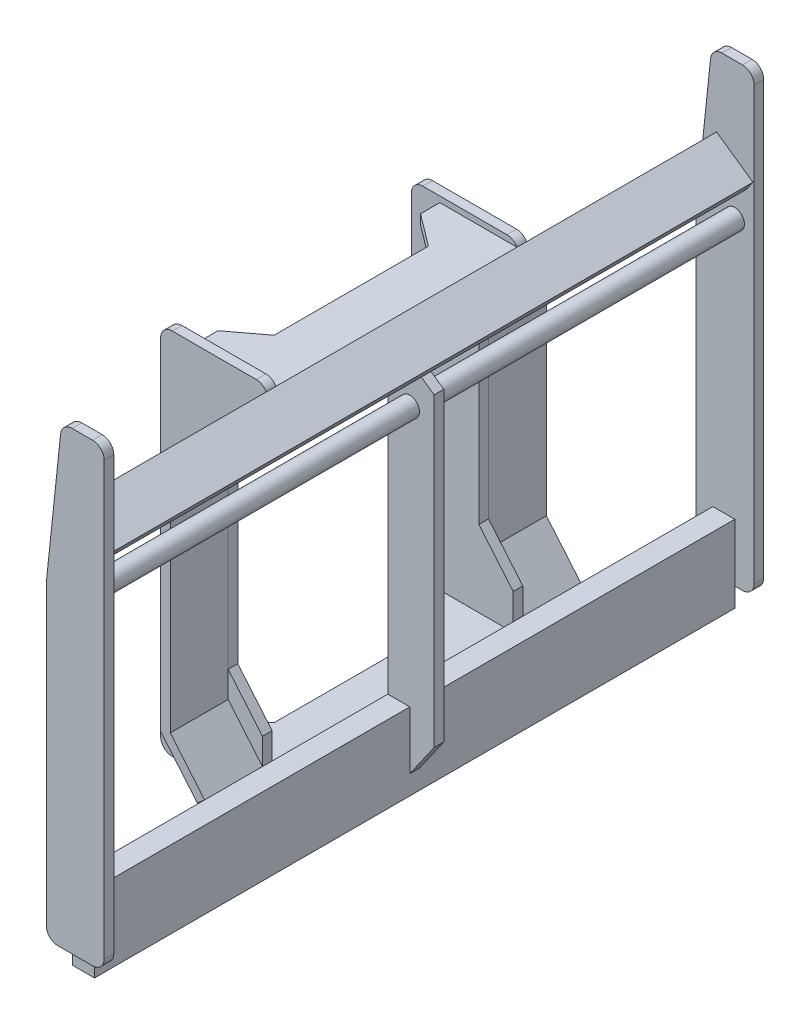
from build123d import *

# Parameters (mm, degrees)
BOSS_EXTRUDE1_START = 830
BOSS_EXTRUDE1_DEPTH = 25
BOSS_EXTRUDE2_START = -830
BOSS_EXTRUDE2_DEPTH = 25
SKETCH2_W           = 57
SKETCH2_H           = 200
BOSS_EXTRUDE3_DEPTH = 1660
BOSS_EXTRUDE4_DEPTH = 12.5
SKETCH4_R           = 25
CUT_EXTRUDE1_DEPTH  = 2084.026644093
SKETCH5_R           = 25
BOSS_EXTRUDE5_DEPTH = 1710
BOSS_EXTRUDE6_START = 300
BOSS_EXTRUDE6_DEPTH = 25
EXTRUDE_THIN1_DEPTH = 150
BOSS_EXTRUDE7_REACH = 1429.616
SKETCH9_W           = 150
SKETCH9_H           = 25
BOSS_EXTRUDE8_DEPTH = 25
LPATTERN1_COUNT     = 2
LPATTERN1_PITCH     = 870
FILLET1_R           = 30


with BuildPart() as part:
    # Sketch1 → Boss-Extrude1 (new body)
    with BuildSketch(Plane.XY.offset(BOSS_EXTRUDE1_START)):
        Polygon((0, 0), (0, 1180), (-110, 1180), (-150, 800), (-150, 0), align=None)
    extrude(amount=BOSS_EXTRUDE1_DEPTH)



with BuildPart() as body_2:
    # Sketch1<2> → Boss-Extrude2 (new body)
    with BuildSketch(Plane.XY.offset(BOSS_EXTRUDE2_START)):
        Polygon((0, 0), (0, 1180), (-110, 1180), (-150, 800), (-150, 0), align=None)
    extrude(amount=-BOSS_EXTRUDE2_DEPTH)


with BuildPart() as part_1:
    add(part.part)

    add(body_2.part)  # Boss-Extrude3 merges body 2
    # Sketch2 → Boss-Extrude3 (add)
    with BuildSketch(Plane.XY.offset(-830)):
        Polygon((-3, 930), (-20.207293091, 905.425438671), (-114.409778184, 971.386728852), (-97.202485093, 995.96129018), align=None)
        with Locations((-78.5, 50)):
            Rectangle(SKETCH2_W, SKETCH2_H)
    extrude(amount=BOSS_EXTRUDE3_DEPTH)

    # Sketch3 → Boss-Extrude4 (add, symmetric)
    with BuildSketch(Plane.XY):
        Polygon((-107, 966.198346311), (13, 882.173441726), (13, 89.973324425), (-50, 0), (-50, 150), (-107, 150), align=None)
    extrude(amount=BOSS_EXTRUDE4_DEPTH, both=True)

    # Sketch4 → Cut-Extrude1 (cut, through all)
    with BuildSketch(Plane.XY.offset(855)):
        with Locations((-50, 825)):
            Circle(SKETCH4_R)
    extrude(amount=-CUT_EXTRUDE1_DEPTH, mode=Mode.SUBTRACT)

    # Sketch5 → Boss-Extrude5 (add)
    with BuildSketch(Plane.XY.offset(855)):
        with Locations(Location((-50, 825, 0), (0, 0, 180))):
            Circle(SKETCH5_R)
    extrude(amount=-BOSS_EXTRUDE5_DEPTH)

    # Sketch7 → Boss-Extrude6 (add)
    with BuildSketch(Plane(origin=(0, 0, -12.5), x_dir=(-1, 0, 0), z_dir=(0, 0, -1)).offset(BOSS_EXTRUDE6_START)):
        Polygon((97.202485093, 995.96129018), (114.409778184, 971.386728852), (107, 966.198346311), (107, 902.667728725), (196, 822.531768783), (196, 323.996024519), (107, 217.929954778), (107, 150), (107, 75), (371, 52.96129018), (371, 1010.96129018), (97.202485093, 1010.96129018), align=None)
    extrude(amount=BOSS_EXTRUDE6_DEPTH)


with BuildPart() as body_2_2:
    # Sketch8 → Extrude-Thin1 (new body)
    with BuildSketch(Plane(origin=(0, 0, -337.5), x_dir=(-1, 0, 0), z_dir=(0, 0, -1))):
        Polygon((107, 150), (196, 256.066069741), (196, 859.753170343), (107, 934.433037518), (123.069690242, 953.584148596), (221, 871.410861797), (221, 246.966813884), (126.151111078, 133.930309758), align=None)
    extrude(amount=EXTRUDE_THIN1_DEPTH)


with BuildPart() as body_3:
    # Boss-Extrude7: up to this plane
    boss_extrude7_end = Plane(origin=(-20.207293091, 905.425438671, 1037.963939182), z_dir=(0.5735764363510444, 0.819152044288993, 0))
    # Sketch9 → Boss-Extrude7 (new, up to the surface)
    with BuildSketch(Plane(origin=(397.328272504, 333.398006914, 0), x_dir=(0, 0, -1), z_dir=(0.7660444431189795, 0.6427876096865376, 0)), mode=Mode.PRIVATE) as boss_extrude7_sk1:
        with Locations((412.5, 797.095510094)):
            Rectangle(SKETCH9_W, SKETCH9_H)
    boss_extrude7_tool1 = split(extrude(boss_extrude7_sk1.sketch, amount=BOSS_EXTRUDE7_REACH, mode=Mode.PRIVATE), bisect_by=boss_extrude7_end, keep=Keep.BOTH, mode=Mode.PRIVATE)
    add(boss_extrude7_tool1.solids().sort_by_distance((-115.034845, 944.008593, -412.5))[0])


with BuildPart() as body_4:
    # Mirror5: mirrored copy
    add(body_2_2.part.mirror(Plane.XY))


with BuildPart() as body_5:
    # Mirror5 2: mirrored copy
    add(body_3.part.mirror(Plane.XY))


with BuildPart() as body_6:
    # Mirror5 3: mirrored copy
    add(part_1.part.mirror(Plane.XY))


with BuildPart() as part_2:
    add(part_1.part)

    add(body_6.part)  # Boss-Extrude8 merges body 6
    # Sketch11 → Boss-Extrude8 (add)
    with BuildSketch(Plane(origin=(0, 995.96129018, 0), x_dir=(-1, 0, 0), z_dir=(0, 1, 0))):
        Polygon((297.202485093, 312.5), (97.202485093, 312.5), (97.202485093, -312.5), (297.202485093, -312.5), (297.202485093, -262.5), (214.409778184, -200), (214.409778184, 200), (297.202485093, 262.5), align=None)
    boss_extrude8 = extrude(amount=-BOSS_EXTRUDE8_DEPTH)

    # LPattern1: Boss-Extrude8 ×2
    with Locations(*[(0, -i * LPATTERN1_PITCH, 0) for i in range(1, LPATTERN1_COUNT)]):
        add(boss_extrude8)

    # Fillet1
    # the kernel refuses this fillet: 30 mm, written as the material it takes off along each edge
    with BuildSketch(Plane(origin=(-97.202485093, 1010.96129018, -247.548094716), x_dir=(0, -1, 0), z_dir=(0, 0, -1))) as fillet1_piece_1:
        with BuildLine():
            CenterArc((30, 25.980762114), FILLET1_R, 180, 60)
            Line((0, 25.980762114), (-0.6, 25.980762114))
            Line((-0.6, 25.980762114), (-0.6, 0))
            Line((-0.6, 0), (0, -0.6))
            ThreePointArc((0, -0.6), (7.5, -0.6), (14.7, -0.519615242))
            Line((14.7, -0.519615242), (15, 0))
        make_face()
    extrude(amount=154.903810568, mode=Mode.SUBTRACT)
    with BuildSketch(Plane(origin=(-97.202485093, 1010.96129018, 247.548094716), x_dir=(0, -1, 0), z_dir=(0, 0, 1))) as fillet1_piece_2:
        with BuildLine():
            CenterArc((30, -25.980762114), FILLET1_R, 120, 60)
            Line((0, -25.980762114), (-0.6, -25.980762114))
            Line((-0.6, -25.980762114), (-0.6, 0))
            Line((-0.6, 0), (0, 0.6))
            ThreePointArc((0, 0.6), (7.5, 0.6), (14.7, 0.519615242))
            Line((14.7, 0.519615242), (15, 0))
        make_face()
    extrude(amount=154.903810568, mode=Mode.SUBTRACT)
    with BuildSketch(Plane(origin=(-371, 1010.96129018, -237.5), x_dir=(1, 0, 0), z_dir=(0, 0, -1)), Plane(origin=(0, 1180, -755), x_dir=(0, -1, 0), z_dir=(0, 0, -1)), Plane(origin=(-150, 0, 755), x_dir=(1, 0, 0), z_dir=(0, 0, 1)), Plane(origin=(-371, 1010.96129018, 237.5), x_dir=(0, -1, 0), z_dir=(0, 0, 1))) as fillet1_piece_3:
        with BuildLine():
            CenterArc((FILLET1_R, FILLET1_R), FILLET1_R, 180, 90)
            Line((0, FILLET1_R), (-FILLET1_R * 0.02, FILLET1_R))
            Line((-FILLET1_R * 0.02, FILLET1_R), (-FILLET1_R * 0.02, -FILLET1_R * 0.02))
            Line((-FILLET1_R * 0.02, -FILLET1_R * 0.02), (FILLET1_R, -FILLET1_R * 0.02))
            Line((FILLET1_R, -FILLET1_R * 0.02), (FILLET1_R, 0))
        make_face()
    extrude(amount=175, mode=Mode.SUBTRACT)
    with BuildSketch(Plane(origin=(-110, 1180, 762.480369048), x_dir=(1, 0, 0), z_dir=(0, 0, 1))) as fillet1_piece_4:
        with BuildLine():
            CenterArc((FILLET1_R * 0.900261746029, -FILLET1_R), FILLET1_R, 90, 83.990994043)
            Line((-FILLET1_R * 0.0942437068928, -FILLET1_R * 0.895315215482), (-FILLET1_R * 0.114133815951, -FILLET1_R * 0.893221519792))
            Line((-FILLET1_R * 0.114133815951, -FILLET1_R * 0.893221519792), (-FILLET1_R * 0.0180052349206, FILLET1_R * 0.02))
            Line((-FILLET1_R * 0.0180052349206, FILLET1_R * 0.02), (FILLET1_R * 0.900261746029, FILLET1_R * 0.02))
            Line((FILLET1_R * 0.900261746029, FILLET1_R * 0.02), (FILLET1_R * 0.900261746029, 0))
        make_face()
    extrude(amount=160.039261904, mode=Mode.SUBTRACT)
    with BuildSketch(Plane(origin=(0, 1180, 755), x_dir=(0, -1, 0), z_dir=(0, 0, 1)), Plane(origin=(0, 0, -755), x_dir=(0, 1, 0), z_dir=(0, 0, -1)), Plane(origin=(0, 0, 755), x_dir=(-1, 0, 0), z_dir=(0, 0, 1)), Plane(origin=(-150, 0, -755), x_dir=(1, 0, 0), z_dir=(0, 0, -1))) as fillet1_piece_5:
        with BuildLine():
            CenterArc((FILLET1_R, -FILLET1_R), FILLET1_R, 90, 90)
            Line((0, -FILLET1_R), (-FILLET1_R * 0.02, -FILLET1_R))
            Line((-FILLET1_R * 0.02, -FILLET1_R), (-FILLET1_R * 0.02, FILLET1_R * 0.02))
            Line((-FILLET1_R * 0.02, FILLET1_R * 0.02), (FILLET1_R, FILLET1_R * 0.02))
            Line((FILLET1_R, FILLET1_R * 0.02), (FILLET1_R, 0))
        make_face()
    extrude(amount=175, mode=Mode.SUBTRACT)
    with BuildSketch(Plane(origin=(-110, 1180, -762.480369048), x_dir=(1, 0, 0), z_dir=(0, 0, -1))) as fillet1_piece_6:
        with BuildLine():
            CenterArc((FILLET1_R * 0.900261746029, FILLET1_R), FILLET1_R, 186.009005957, 83.990994043)
            Line((-FILLET1_R * 0.0942437068928, FILLET1_R * 0.895315215482), (-FILLET1_R * 0.114133815951, FILLET1_R * 0.893221519792))
            Line((-FILLET1_R * 0.114133815951, FILLET1_R * 0.893221519792), (-FILLET1_R * 0.0180052349206, -FILLET1_R * 0.02))
            Line((-FILLET1_R * 0.0180052349206, -FILLET1_R * 0.02), (FILLET1_R * 0.900261746029, -FILLET1_R * 0.02))
            Line((FILLET1_R * 0.900261746029, -FILLET1_R * 0.02), (FILLET1_R * 0.900261746029, 0))
        make_face()
    extrude(amount=160.039261904, mode=Mode.SUBTRACT)
    with BuildSketch(Plane(origin=(-371, 52.96129018, 230.978122717), x_dir=(0.9965336550031195, 0.08319059109132182, 0), z_dir=(0, 0, 1))) as fillet1_piece_7:
        with BuildLine():
            CenterArc((FILLET1_R * 1.08695836378, FILLET1_R), FILLET1_R, 175.228015178, 94.771984822)
            Line((FILLET1_R * 0.0904247087743, FILLET1_R * 1.08319059109), (FILLET1_R * 0.0704940356742, FILLET1_R * 1.08485440291))
            Line((FILLET1_R * 0.0704940356742, FILLET1_R * 1.08485440291), (-FILLET1_R * 0.0217391672755, -FILLET1_R * 0.02))
            Line((-FILLET1_R * 0.0217391672755, -FILLET1_R * 0.02), (FILLET1_R * 1.08695836378, -FILLET1_R * 0.02))
            Line((FILLET1_R * 1.08695836378, -FILLET1_R * 0.02), (FILLET1_R * 1.08695836378, 0))
        make_face()
    extrude(amount=188.043754567, mode=Mode.SUBTRACT)
    with BuildSketch(Plane(origin=(-371, 52.96129018, -230.978122717), x_dir=(0.9965336550031195, 0.08319059109132182, 0), z_dir=(0, 0, -1))) as fillet1_piece_8:
        with BuildLine():
            CenterArc((FILLET1_R * 1.08695836378, -FILLET1_R), FILLET1_R, 90, 94.771984822)
            Line((FILLET1_R * 0.0904247087743, -FILLET1_R * 1.08319059109), (FILLET1_R * 0.0704940356742, -FILLET1_R * 1.08485440291))
            Line((FILLET1_R * 0.0704940356742, -FILLET1_R * 1.08485440291), (-FILLET1_R * 0.0217391672755, FILLET1_R * 0.02))
            Line((-FILLET1_R * 0.0217391672755, FILLET1_R * 0.02), (FILLET1_R * 1.08695836378, FILLET1_R * 0.02))
            Line((FILLET1_R * 1.08695836378, FILLET1_R * 0.02), (FILLET1_R * 1.08695836378, 0))
        make_face()
    extrude(amount=188.043754567, mode=Mode.SUBTRACT)


solid = Compound([body_2_2.part, body_3.part, body_4.part, body_5.part, part_2.part])
